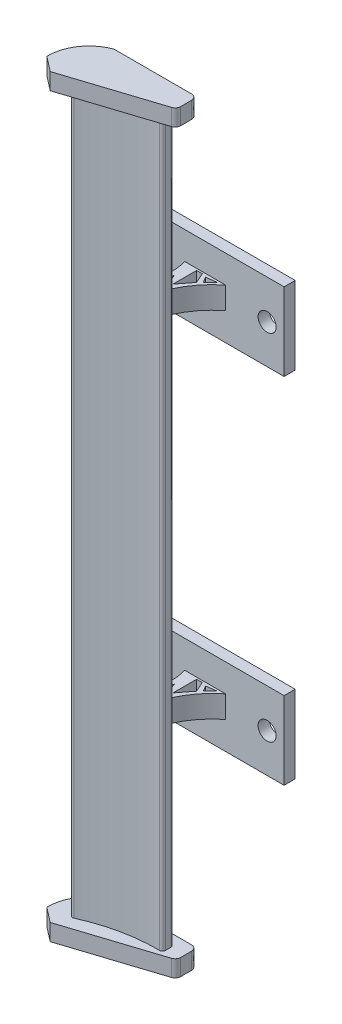
from build123d import *

# Parameters (mm, degrees)
CROQUIS1_W                = 29.1
CROQUIS1_H                = 14
CROQUIS1_R                = 1.625
SALIENTE_EXTRUIR1_DEPTH   = 2
SALIENTE_EXTRUIR1_2_DEPTH = 2
CROQUIS2_W                = 8
CROQUIS2_H                = 8
SALIENTE_EXTRUIR2_DEPTH   = 7
CROQUIS3_W                = 28
CROQUIS3_H                = 135.79635
SALIENTE_EXTRUIR3_DEPTH   = 8
CORTAR_EXTRUIR1_START     = -135.79635
CORTAR_EXTRUIR1_DEPTH     = 135.79635
REDONDEO1_R               = 0.5
REDONDEO2_R               = 0.5
CROQUIS5_W                = 2
CROQUIS5_H                = 32
CROQUIS5_H_2              = 55.79635
CORTAR_EXTRUIR2_DEPTH     = 8
SALIENTE_EXTRUIR4_DEPTH   = 3
REDONDEO4_R               = 1
SALIENTE_EXTRUIR5_DEPTH   = 3
CORTAR_EXTRUIR4_START     = -71.79635
CORTAR_EXTRUIR4_DEPTH     = 71.79635
SALIENTE_EXTRUIR7_START   = -8
SALIENTE_EXTRUIR7_DEPTH   = 8
SALIENTE_EXTRUIR8_START   = -8
SALIENTE_EXTRUIR8_DEPTH   = 8
CORTAR_EXTRUIR5_START     = -71.79635
CORTAR_EXTRUIR5_DEPTH     = 71.79635
REDONDEO5_R               = 4
CORTAR_EXTRUIR6_START     = -21.901142
CROQUIS15_W               = 9
CROQUIS15_H               = 2
CORTAR_EXTRUIR6_DEPTH     = 14.356142
CORTAR_EXTRUIR7_START     = -103.79635
CROQUIS16_W               = 5.770605939
CROQUIS16_H               = 2
CROQUIS16_W_2             = 12.752116736
CORTAR_EXTRUIR7_DEPTH     = 129.79635
CROQUIS17_W               = 9.132432918
CROQUIS17_H               = 14
CROQUIS17_R               = 1.625
CROQUIS17_W_2             = 9.390289757
SALIENTE_EXTRUIR9_DEPTH   = 2


with BuildPart() as part:
    # Croquis1 → Saliente-Extruir1 (new body)
    with BuildSketch(Plane.XY):
        with Locations((0, -56.79635)):
            Rectangle(CROQUIS1_W, CROQUIS1_H)
        with Locations((11.49, -56.79635)):
            Circle(CROQUIS1_R, mode=Mode.SUBTRACT)
        with Locations((-11.5, -56.79635)):
            Circle(CROQUIS1_R, mode=Mode.SUBTRACT)
    extrude(amount=SALIENTE_EXTRUIR1_DEPTH)



with BuildPart() as body_2:
    # Croquis1 → Saliente-Extruir1 2 (new body)
    with BuildSketch(Plane.XY):
        with Locations((0, 7)):
            Rectangle(CROQUIS1_W, CROQUIS1_H)
        with Locations((-11.5, 7)):
            Circle(CROQUIS1_R, mode=Mode.SUBTRACT)
        with Locations((11.49, 7)):
            Circle(CROQUIS1_R, mode=Mode.SUBTRACT)
    extrude(amount=SALIENTE_EXTRUIR1_2_DEPTH)


with BuildPart() as part_1:
    add(part.part)

    add(body_2.part)  # Saliente-Extruir2 merges body 2
    # Croquis2 → Saliente-Extruir2 (add)
    with BuildSketch(Plane.XY.offset(2)):
        with Locations((-0.005, 7)):
            Rectangle(CROQUIS2_W, CROQUIS2_H)
        with Locations((-0.005, -56.79635)):
            Rectangle(CROQUIS2_W, CROQUIS2_H)
    extrude(amount=SALIENTE_EXTRUIR2_DEPTH)

    # Croquis3 → Saliente-Extruir3 (add)
    with BuildSketch(Plane.XY.offset(9)):
        with Locations((-0.005, -24.898175)):
            Rectangle(CROQUIS3_W, CROQUIS3_H)
    extrude(amount=SALIENTE_EXTRUIR3_DEPTH)

    # Croquis4 → Cortar-Extruir1 (cut)
    with BuildSketch(Plane(origin=(0, 43, 0), x_dir=(1, 0, 0), z_dir=(0, 1, 0)).offset(CORTAR_EXTRUIR1_START)):
        with BuildLine():
            Line((3.995, -9), (3.995, -11))
            Line((3.995, -11), (6.995, -11))
            Line((6.995, -11), (6.995, -13))
            ThreePointArc((6.995, -13), (-0.186595872, -13.652552595), (-7.005, -16))
            Line((-7.005, -16), (-7.005, -13))
            Line((-7.005, -13), (-7.005, -11))
            Line((-7.005, -11), (-4.005, -11))
            Line((-4.005, -11), (-4.005, -9))
            Line((-4.005, -9), (-14.005, -9))
            Line((-14.005, -9), (-14.005, -17))
            Line((-14.005, -17), (13.995, -17))
            Line((13.995, -17), (13.995, -9))
            Line((13.995, -9), (3.995, -9))
        make_face()
    extrude(amount=CORTAR_EXTRUIR1_DEPTH, mode=Mode.SUBTRACT)

    # Redondeo1
    redondeo1_edges = [part_1.edges().sort_by_distance(p)[0] for p in [
        (6.995, -24.898175, 13),
        (6.995, -24.898175, 11),
    ]]
    fillet(redondeo1_edges, radius=REDONDEO1_R)

    # Redondeo2
    redondeo2_edges = [part_1.edges().sort_by_distance(p)[0] for p in [
        (-7.005, -24.898175, 16),
    ]]
    fillet(redondeo2_edges, radius=REDONDEO2_R)

    # Croquis5 → Cortar-Extruir2 (cut)
    with BuildSketch(Plane.ZY.offset(4.005)):
        with Locations((10, 27)):
            Rectangle(CROQUIS5_W, CROQUIS5_H)
        with Locations((10, -24.898175)):
            Rectangle(CROQUIS5_W, CROQUIS5_H_2)
        with Locations((10, -76.79635)):
            Rectangle(CROQUIS5_W, CROQUIS5_H)
    extrude(amount=-CORTAR_EXTRUIR2_DEPTH, mode=Mode.SUBTRACT)

    # Croquis6 → Saliente-Extruir4 (add)
    with BuildSketch(Plane(origin=(0, 43, 0), x_dir=(1, 0, 0), z_dir=(0, 1, 0))):
        with BuildLine():
            Line((9.457278185, -12.908301876), (-7.759178779, -18.474170155))
            Line((-7.759178779, -18.474170155), (-10.447776168, -16.398761645))
            ThreePointArc((-10.447776168, -16.398761645), (-9.123523754, -12.023120399), (-5.505, -9.229168607))
            Line((-5.505, -9.229168607), (9.457278185, -9.229168607))
            Line((9.457278185, -9.229168607), (9.457278185, -12.908301876))
        make_face()
    extrude(amount=-SALIENTE_EXTRUIR4_DEPTH)

    # Redondeo4
    redondeo4_edges = [part_1.edges().sort_by_distance(p)[0] for p in [
        (9.457278185, 41.5, 9.229168607),
        (9.457278185, 41.5, 12.908301876),
    ]]
    fillet(redondeo4_edges, radius=REDONDEO4_R)

    # Croquis7 → Saliente-Extruir5 (add)
    with BuildSketch(Plane.XZ.offset(92.79635)):
        with BuildLine():
            Line((-7.759178779, 18.474170155), (8.76489024, 13.132142363))
            ThreePointArc((8.76489024, 13.132142363), (9.265860913, 12.769013006), (9.457278185, 12.180630501))
            Line((9.457278185, 12.180630501), (9.457278185, 10.229168607))
            ThreePointArc((9.457278185, 10.229168607), (9.164384967, 9.522061826), (8.457278185, 9.229168607))
            Line((8.457278185, 9.229168607), (-5.505, 9.229168607))
            ThreePointArc((-5.505, 9.229168607), (-9.123523754, 12.023120399), (-10.447776168, 16.398761645))
            Line((-10.447776168, 16.398761645), (-7.759178779, 18.474170155))
        make_face()
    extrude(amount=-SALIENTE_EXTRUIR5_DEPTH)

    # Croquis11 → Cortar-Extruir4 (cut)
    with BuildSketch(Plane(origin=(0, 11, 0), x_dir=(1, 0, 0), z_dir=(0, 1, 0)).offset(CORTAR_EXTRUIR4_START)):
        with BuildLine():
            Line((-4.005, -11), (-3.005, -11))
            ThreePointArc((-3.005, -11), (-0.024192095, -6.993590584), (0, -2))
            Line((0, -2), (-4.005, -2))
            Line((-4.005, -2), (-4.005, -11))
        make_face()
        with BuildLine():
            Line((3.995, -11), (1.995, -11))
            ThreePointArc((1.995, -11), (2.742037907, -8.281661906), (3.995, -5.756287949))
            Line((3.995, -5.756287949), (3.995, -11))
        make_face()
    extrude(amount=CORTAR_EXTRUIR4_DEPTH, mode=Mode.SUBTRACT)

    # Croquis12 → Saliente-Extruir7 (add)
    with BuildSketch(Plane(origin=(0, 11, 0), x_dir=(1, 0, 0), z_dir=(0, 1, 0)).offset(SALIENTE_EXTRUIR7_START)):
        with BuildLine():
            Line((3.995, -2), (7.351142184, -2))
            ThreePointArc((7.351142184, -2), (5.510724817, -3.733091947), (3.995, -5.756287949))
            Line((3.995, -5.756287949), (3.995, -2))
        make_face()
    extrude(amount=SALIENTE_EXTRUIR7_DEPTH)

    # Croquis13 → Saliente-Extruir8 (add)
    with BuildSketch(Plane.XZ.offset(60.79635).offset(SALIENTE_EXTRUIR8_START)):
        with BuildLine():
            Line((3.995, 5.756287949), (3.995, 2))
            Line((3.995, 2), (7.351142184, 2))
            ThreePointArc((7.351142184, 2), (5.510724817, 3.733091947), (3.995, 5.756287949))
        make_face()
    extrude(amount=SALIENTE_EXTRUIR8_DEPTH)

    # Croquis14 → Cortar-Extruir5 (cut)
    with BuildSketch(Plane(origin=(0, 11, 0), x_dir=(1, 0, 0), z_dir=(0, 1, 0)).offset(CORTAR_EXTRUIR5_START)):
        Polygon((6.21693803, -2.324666095), (4.927658189, -3.565597942), (4.331366262, -2.566406065), align=None)
        Polygon((3.493334365, -2.324666095), (2.47802649, -2.324666095), (2.47802649, -6.595405569), (4.331366262, -4.210237863), align=None)
        Polygon((1.235275319, -5.075942388), (2.002667058, -7.167084876), (1.235275319, -8.490835625), (0.160926885, -8.68268356), align=None)
        Polygon((0.97157316, -10.515246809), (-1.531379092, -10.515246809), (1.235275319, -9.257285848), align=None)
    extrude(amount=CORTAR_EXTRUIR5_DEPTH, mode=Mode.SUBTRACT)

    # Redondeo5
    redondeo5_edges = [part_1.edges().sort_by_distance(p)[0] for p in [
        (-7.005, -24.898175, 11),
    ]]
    fillet(redondeo5_edges, radius=REDONDEO5_R - 0.0001)  # a hair under: the kernel refuses the full size

    # Croquis15 → Cortar-Extruir6 (cut)
    with BuildSketch(Plane.ZY.offset(14.55).offset(CORTAR_EXTRUIR6_START)):
        with Locations((6.5, 10)):
            Rectangle(CROQUIS15_W, CROQUIS15_H)
        with Locations((6.5, 4)):
            Rectangle(CROQUIS15_W, CROQUIS15_H)
        with Locations((6.5, -53.79635)):
            Rectangle(CROQUIS15_W, CROQUIS15_H)
        with Locations((6.5, -59.79635)):
            Rectangle(CROQUIS15_W, CROQUIS15_H)
    extrude(amount=CORTAR_EXTRUIR6_DEPTH, mode=Mode.SUBTRACT)

    # Croquis16 → Cortar-Extruir7 (cut)
    with BuildSketch(Plane(origin=(0, 14, 0), x_dir=(1, 0, 0), z_dir=(0, 1, 0)).offset(CORTAR_EXTRUIR7_START)):
        with Locations((11.664697031, -1)):
            Rectangle(CROQUIS16_W, CROQUIS16_H)
        with Locations((-8.173941632, -1)):
            Rectangle(CROQUIS16_W_2, CROQUIS16_H)
    extrude(amount=CORTAR_EXTRUIR7_DEPTH, mode=Mode.SUBTRACT)

    # Croquis17 → Saliente-Extruir9 (add)
    # profile 1 of 4: a face of its own
    with BuildSketch(Plane.XY.offset(2)):
        with Locations((13.34561052, 7)):
            Rectangle(CROQUIS17_W, CROQUIS17_H)
        with Locations((14.851826979, 7)):
            Circle(CROQUIS17_R, mode=Mode.SUBTRACT)
    # profile 2 of 4: a face of its own
    with BuildSketch(Plane.XY.offset(2)):
        with Locations((-6.493028143, 7)):
            Rectangle(CROQUIS17_W_2, CROQUIS17_H)
        with Locations((-8.138173021, 7)):
            Circle(CROQUIS17_R, mode=Mode.SUBTRACT)
    # profile 3 of 4: a face of its own
    with BuildSketch(Plane.XY.offset(2)):
        with Locations((-6.493028143, -56.79635)):
            Rectangle(CROQUIS17_W_2, CROQUIS17_H)
        with Locations((-8.138173021, -56.79635)):
            Circle(CROQUIS17_R, mode=Mode.SUBTRACT)
    # profile 4 of 4: a face of its own
    with BuildSketch(Plane.XY.offset(2)):
        with Locations((13.34561052, -56.79635)):
            Rectangle(CROQUIS17_W, CROQUIS17_H)
        with Locations((14.851826979, -56.79635)):
            Circle(CROQUIS17_R, mode=Mode.SUBTRACT)
    extrude(amount=-SALIENTE_EXTRUIR9_DEPTH)


solid = part_1.part
